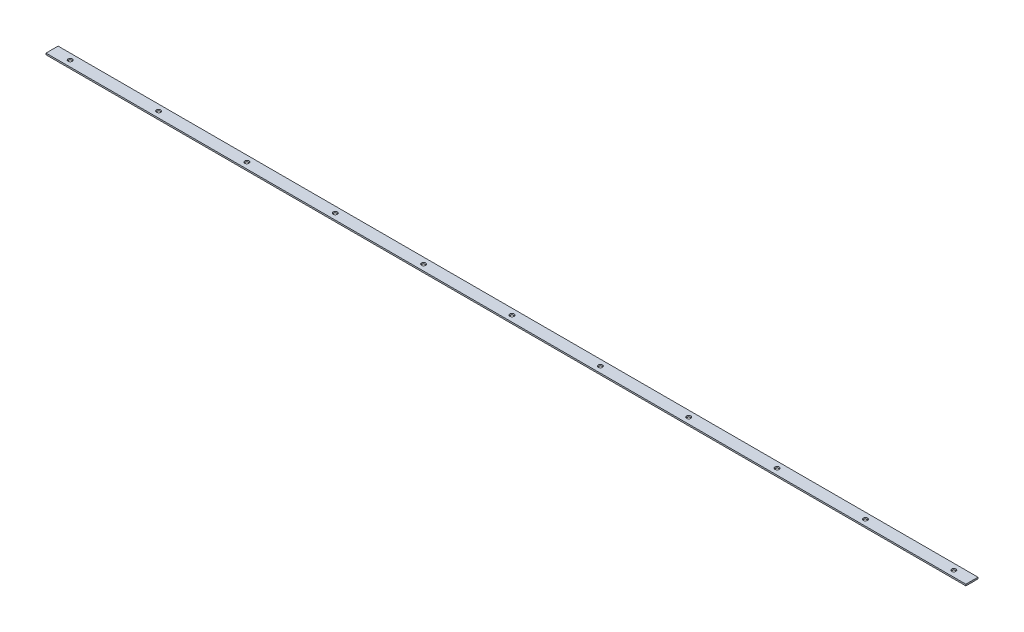
from build123d import *

# Parameters (mm, degrees)
SKETCH1_W           = 1520
SKETCH1_H           = 20
BASE_FLANGE1_DEPTH  = 2.5
SKETCH6_R           = 3.5
CUT_EXTRUDE1_DEPTH  = 10
LPATTERN1_COUNT     = 6
LPATTERN1_PITCH     = 146
LPATTERN1_COL_COUNT = 6
LPATTERN1_COL_PITCH = 146


# Sheet-metal steps are written as plain solids
with BuildPart() as part:
    # Sketch1 → Base-Flange1 (new body)
    with BuildSketch(Plane(origin=(0, 0, 0), x_dir=(1, 0, 0), z_dir=(0, 1, 0))):
        Rectangle(SKETCH1_W, SKETCH1_H)
    extrude(amount=-BASE_FLANGE1_DEPTH)

    # Sketch6 → Cut-Extrude1 (cut)
    with BuildSketch(Plane(origin=(0, 0, 0), x_dir=(1, 0, 0), z_dir=(0, 1, 0))):
        with Locations(Location((0, 0, 0), (0, 0, 270))):
            Circle(SKETCH6_R)
    cut_extrude1 = extrude(amount=-CUT_EXTRUDE1_DEPTH, mode=Mode.SUBTRACT)

    # LPattern1: Cut-Extrude1 ×6
    with Locations(*[(-i * LPATTERN1_PITCH, 0, 0) for i in range(1, LPATTERN1_COUNT)]):
        add(cut_extrude1, mode=Mode.SUBTRACT)

    # LPattern1 col: Cut-Extrude1 ×6
    with Locations(*[(i * LPATTERN1_COL_PITCH, 0, 0) for i in range(1, LPATTERN1_COL_COUNT)]):
        add(cut_extrude1, mode=Mode.SUBTRACT)


solid = part.part
